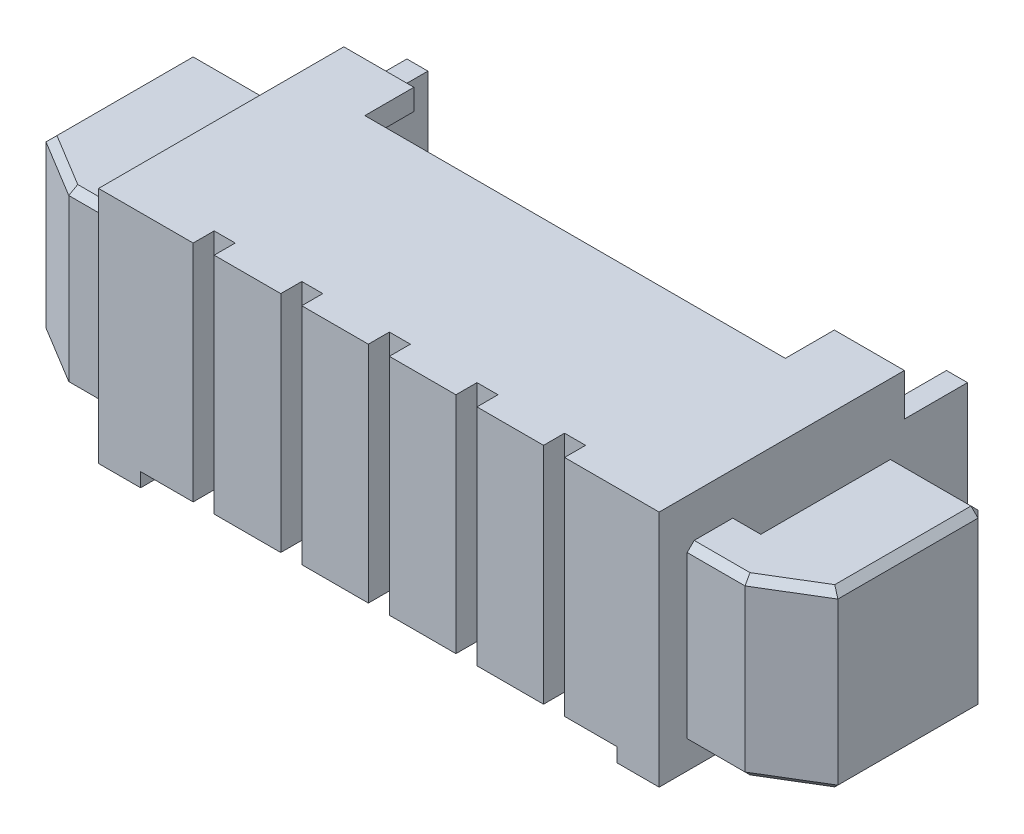
from build123d import *

# Parameters (mm, degrees)
SKETCH1_W                = 8
SKETCH1_H                = 4.4
BOSS_EXTRUDE1_DEPTH      = 3.4
SKETCH4_W                = 6.8
SKETCH4_H                = 4.4
CUT_EXTRUDE1_DEPTH       = 0.2
SHELL1_START             = -3.7
SHELL1_OUTLINE_W         = 2.6
SHELL1_OUTLINE_H         = 4.1
SHELL1_DEPTH             = 7.4
CUT_EXTRUDE3_REACH       = 8.85
SKETCH8_W                = 7.4
SKETCH8_H                = 2.6
BOSS_EXTRUDE2_DEPTH      = 0.3
SKETCH3_3_W              = 0.3
SKETCH3_3_H              = 1.4
CUT_EXTRUDE4_DEPTH       = 7.849817516
SKETCH9_W                = 0.3
SKETCH9_H                = 0.8
CUT_EXTRUDE5_DEPTH       = 7.849817516
SKETCH10_W               = 8
SKETCH10_H               = 0.9
CUT_EXTRUDE6_DEPTH       = 0.6
SKETCH11_W               = 6
SKETCH11_H               = 0.7
CUT_EXTRUDE7_DEPTH       = 1
BOSS_EXTRUDE3_START      = -0.3
BOSS_EXTRUDE3_DEPTH      = 2.5
CHAMFER1_SIZE            = 0.1
CHAMFER1_OF_MIRROR2_SIZE = 0.1


# Read off the part's stored shape, not the designer's step: Shell1
with BuildPart() as part:
    # Sketch1 → Boss-Extrude1 (new body)
    with BuildSketch(Plane(origin=(0, 0, 0), x_dir=(1, 0, 0), z_dir=(0, 1, 0))):
        with Locations((0, -2.2)):
            Rectangle(SKETCH1_W, SKETCH1_H)
    extrude(amount=BOSS_EXTRUDE1_DEPTH)

    # Sketch4 → Cut-Extrude1 (cut)
    with BuildSketch(Plane.XZ):
        with Locations((0, 2.2)):
            Rectangle(SKETCH4_W, SKETCH4_H)
    extrude(amount=-CUT_EXTRUDE1_DEPTH, mode=Mode.SUBTRACT)

    # Shell1 outline → Shell1 (cut)
    with BuildSketch(Plane.YZ.offset(SHELL1_START)):
        with Locations((1.8, 2.05)):
            Rectangle(SHELL1_OUTLINE_W, SHELL1_OUTLINE_H)
    extrude(amount=SHELL1_DEPTH, mode=Mode.SUBTRACT)

    # Sketch3 → Cut-Extrude3 (cut, up to next)
    with BuildSketch(Plane(origin=(0, 0, 0), x_dir=(1, 0, 0), z_dir=(0, 1, 0)), mode=Mode.PRIVATE) as cut_extrude3_sk1:
        Polygon((-1.6, -1.6), (-1.6, 0), (-2.1, 0), (-2.1, -1.6), (-2.35, -1.6), (-2.35, -3.1), (-1.35, -3.1), (-1.35, -1.6), align=None)
    cut_extrude3_tool1 = extrude(cut_extrude3_sk1.sketch, amount=CUT_EXTRUDE3_REACH, mode=Mode.PRIVATE) & part.part
    cut_extrude3 = cut_extrude3_tool1.solids().sort_by_distance((-1.85, 0, 1.81087))[0]
    add(cut_extrude3, mode=Mode.SUBTRACT)

    # Mirror1: Cut-Extrude3 across plane
    add(cut_extrude3.mirror(Plane(origin=(0, 0, 0), x_dir=(0, 0, 1), z_dir=(1, 0, 0))), mode=Mode.SUBTRACT)

    # Sketch8 → Boss-Extrude2 (add)
    with BuildSketch(Plane(origin=(0, 0, 4.1), x_dir=(-1, 0, 0), z_dir=(0, 0, -1))):
        with Locations((0, 1.8)):
            Rectangle(SKETCH8_W, SKETCH8_H)
    extrude(amount=BOSS_EXTRUDE2_DEPTH)

    # Sketch3<3> → Cut-Extrude4 (cut, through all)
    with BuildSketch(Plane(origin=(0, 0, 0), x_dir=(1, 0, 0), z_dir=(0, 1, 0))):
        with Locations((-2.5, -4.8)):
            Rectangle(SKETCH3_3_W, SKETCH3_3_H)
        with Locations((-1.25, -4.8)):
            Rectangle(SKETCH3_3_W, SKETCH3_3_H)
        with Locations((0, -4.8)):
            Rectangle(SKETCH3_3_W, SKETCH3_3_H)
        with Locations((1.25, -4.8)):
            Rectangle(SKETCH3_3_W, SKETCH3_3_H)
        with Locations((2.5, -4.8)):
            Rectangle(SKETCH3_3_W, SKETCH3_3_H)
    extrude(amount=CUT_EXTRUDE4_DEPTH, mode=Mode.SUBTRACT)

    # Sketch9 → Cut-Extrude5 (cut, through all)
    with BuildSketch(Plane.XY):
        with Locations((-2.5, 1.4)):
            Rectangle(SKETCH9_W, SKETCH9_H)
        with Locations((-1.25, 1.4)):
            Rectangle(SKETCH9_W, SKETCH9_H)
        with Locations((0, 1.4)):
            Rectangle(SKETCH9_W, SKETCH9_H)
        with Locations((1.25, 1.4)):
            Rectangle(SKETCH9_W, SKETCH9_H)
        with Locations((2.5, 1.4)):
            Rectangle(SKETCH9_W, SKETCH9_H)
    extrude(amount=CUT_EXTRUDE5_DEPTH, mode=Mode.SUBTRACT)

    # Sketch10 → Cut-Extrude6 (cut)
    with BuildSketch(Plane(origin=(0, 3.4, 0), x_dir=(1, 0, 0), z_dir=(0, 1, 0))):
        with Locations((0, -0.45)):
            Rectangle(SKETCH10_W, SKETCH10_H)
    extrude(amount=-CUT_EXTRUDE6_DEPTH, mode=Mode.SUBTRACT)

    # Sketch11 → Cut-Extrude7 (cut)
    with BuildSketch(Plane(origin=(0, 3.4, 0), x_dir=(1, 0, 0), z_dir=(0, 1, 0))):
        with Locations((0, -1.25)):
            Rectangle(SKETCH11_W, SKETCH11_H)
    extrude(amount=-CUT_EXTRUDE7_DEPTH, mode=Mode.SUBTRACT)

    # Sketch12 → Boss-Extrude3 (add)
    with BuildSketch(Plane.XZ.offset(BOSS_EXTRUDE3_START)):
        Polygon((4, 4), (4.825, 4), (5.65, 3.5), (5.65, 1.4), (4.3, 1.4), (4.3, 3.25), (4, 3.25), align=None)
    boss_extrude3 = extrude(amount=-BOSS_EXTRUDE3_DEPTH)

    # Chamfer1
    chamfer1_edges = [part.edges().sort_by_distance(p)[0] for p in [
        (4.4125, 2.8, 4),
        (5.2375, 2.8, 3.75),
        (5.65, 2.8, 2.45),
        (4.975, 2.8, 1.4),
        (5.65, 1.55, 1.4),
        (4.3, 2.8, 2.325),
        (4.3, 1.55, 1.4),
        (4.15, 2.8, 3.25),
        (4.15, 0.3, 3.25),
        (4.3, 0.3, 2.325),
        (4.975, 0.3, 1.4),
        (5.65, 0.3, 2.45),
        (5.2375, 0.3, 3.75),
        (4.4125, 0.3, 4),
    ]]
    chamfer(chamfer1_edges, length=CHAMFER1_SIZE)

    # Mirror2: Boss-Extrude3 across plane
    add(boss_extrude3.mirror(Plane(origin=(0, 0, 0), x_dir=(0, 0, 1), z_dir=(1, 0, 0))))

    # Chamfer1 of Mirror2
    chamfer1_of_mirror2_edges = [part.edges().sort_by_distance(p)[0] for p in [
        (-4.4125, 2.8, 4),
        (-5.2375, 2.8, 3.75),
        (-5.65, 2.8, 2.45),
        (-4.975, 2.8, 1.4),
        (-5.65, 1.55, 1.4),
        (-4.3, 2.8, 2.325),
        (-4.3, 1.55, 1.4),
        (-4.15, 2.8, 3.25),
        (-4.15, 0.3, 3.25),
        (-4.3, 0.3, 2.325),
        (-4.975, 0.3, 1.4),
        (-5.65, 0.3, 2.45),
        (-5.2375, 0.3, 3.75),
        (-4.4125, 0.3, 4),
    ]]
    chamfer(chamfer1_of_mirror2_edges, length=CHAMFER1_OF_MIRROR2_SIZE)


solid = part.part
